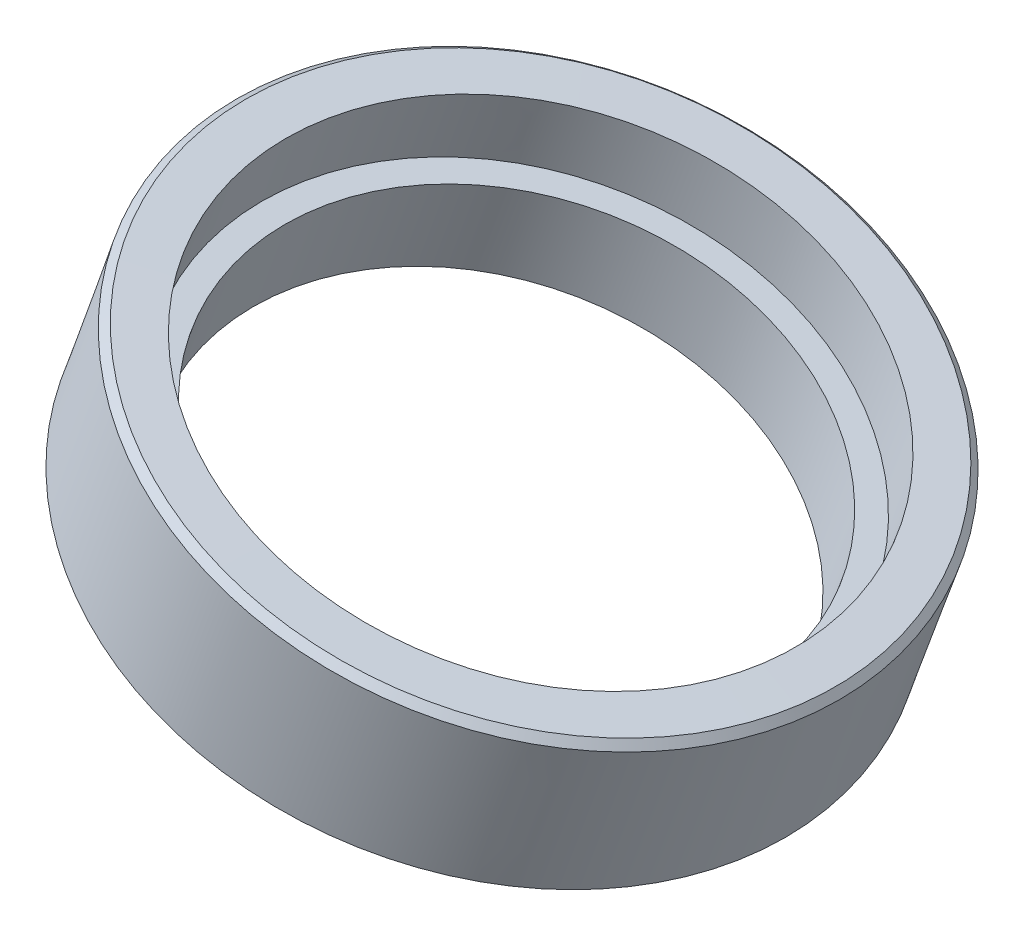
from build123d import *
from OCP.BRepFilletAPI import BRepFilletAPI_MakeChamfer

# Parameters (mm, degrees)
ZKOSEN_1_SIZE  = 0.5
ZKOSEN_1_SIZE2 = 0.502169187
ZKOSEN_2_SIZE  = 0.5


with BuildPart() as part:
    # Skica2 → Rotovat1 (revolve)
    with BuildSketch(Plane.XY):
        Polygon((-356.760195343, -28.070111108), (-358.49053217, -32.761159441), (-360.13334529, -32.163224365), (-362.556589004, -38.821031754), (-357.653518871, -40.605603339), (-353.47646151, -29.281346886), align=None)
    revolve(axis=Axis((-372.880596884, -16.019433279, 0), (-0.3420201433256686, -0.9396926207859085, 0)))

    # Zkosení1: one chamfer whose edges measure the first distance from different faces: ONE call of the kernel's chamfer builder (chamfer() names one face for all edges)
    zkosen_1_edges_1 = [part.edges().sort_by_distance(p)[0] for p in [
        (-396.269620709, -13.705910707, 0),
    ]]
    zkosen_1_edges_2 = [part.edges().sort_by_distance(p)[0] for p in [
        (-400.348900865, -25.065755152, 0),
    ]]
    zkosen_1_side_2 = [part.faces().sort_by_distance(p)[0] for p in [
        (-396.049634615, -26.630560097, 0),
    ]]
    zkosen_1 = BRepFilletAPI_MakeChamfer(part.part.solid().wrapped)
    for e in zkosen_1_edges_1:
        zkosen_1.Add(ZKOSEN_1_SIZE, e.wrapped)
    for e in zkosen_1_edges_2:
        zkosen_1.Add(ZKOSEN_1_SIZE, ZKOSEN_1_SIZE2, e.wrapped, zkosen_1_side_2[0].wrapped)  # the first distance lies on this face
    add(Compound.cast(zkosen_1.Shape()), mode=Mode.REPLACE)

    # Zkosení2
    zkosen_2_edges = [part.edges().sort_by_distance(p)[0] for p in [
        (-395.445830732, -26.850326737, 0),
    ]]
    chamfer(zkosen_2_edges, length=ZKOSEN_2_SIZE)


solid = part.part
